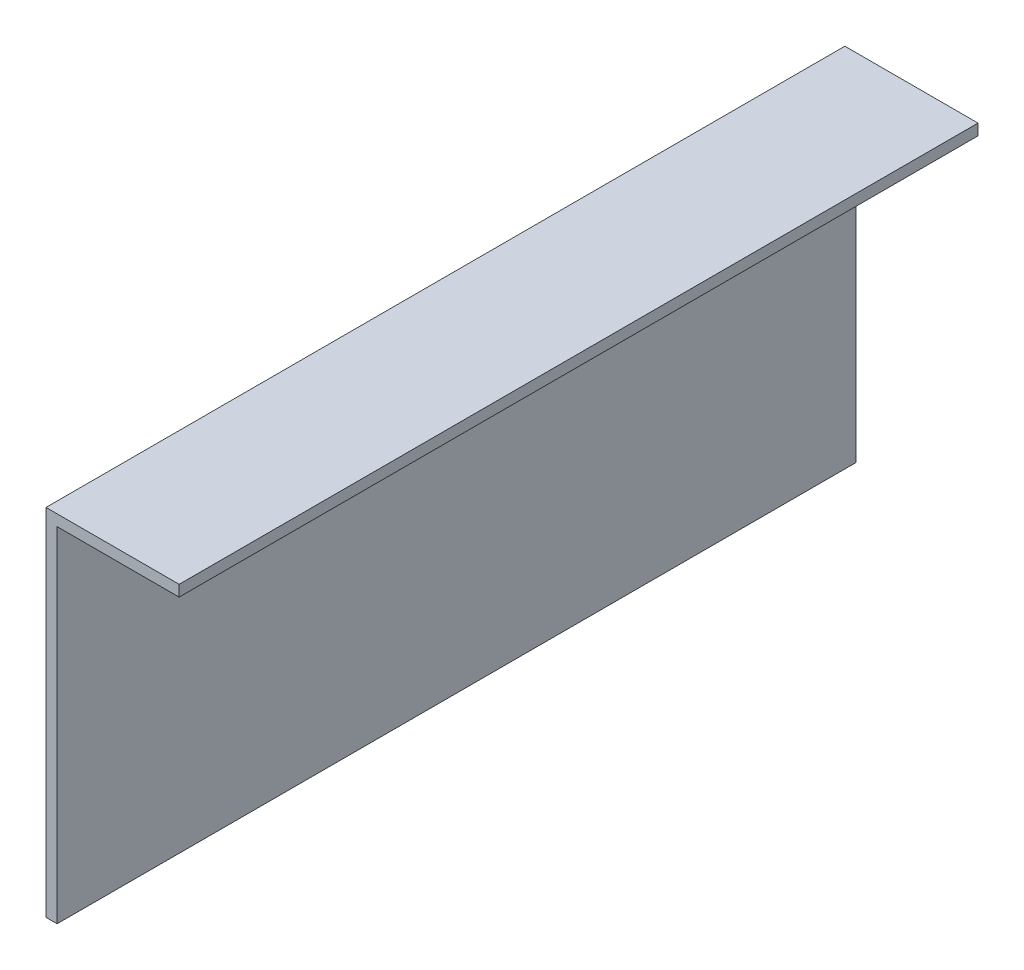
from build123d import *

# Parameters (mm, degrees)
BOSS_EXTRUDE1_DEPTH = 228.6


with BuildPart() as part:
    # Sketch1 → Boss-Extrude1 (new body)
    with BuildSketch(Plane.XY):
        Polygon((1.5875, 47.625), (36.5125, 47.625), (36.5125, 50.8), (-1.5875, 50.8), (-1.5875, -50.8), (1.5875, -50.8), align=None)
    extrude(amount=BOSS_EXTRUDE1_DEPTH)


solid = part.part
